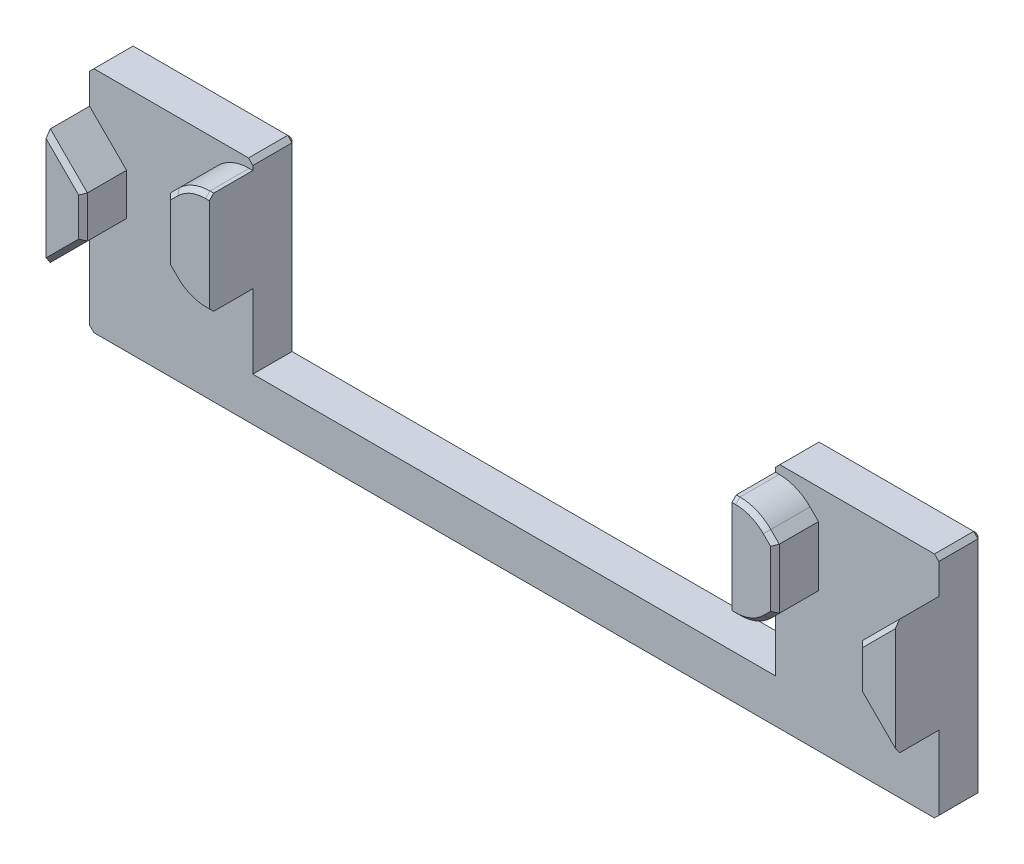
from build123d import *

# Parameters (mm, degrees)
BOSS_EXTRUDE1_DEPTH = 2
SLOT_ALIGNER_DEPTH  = 2
ALIGNER_DEPTH       = 2
DEBURS_SIZE         = 0.2


with BuildPart() as part:
    # Sketch1 → Boss-Extrude1 (new body)
    with BuildSketch(Plane.XY):
        Polygon((-19.3, -5.25), (19.3, -5.25), (19.5, -5.05), (19.5, 5.05), (19.3, 5.25), (12.2, 5.25), (12, 5.05), (12, -3.25), (-12, -3.25), (-12, 5.05), (-12.2, 5.25), (-19.3, 5.25), (-19.5, 5.05), (-19.5, -5.05), align=None)
    extrude(amount=-BOSS_EXTRUDE1_DEPTH)

    # Sketch3 → Slot Aligner (add)
    with BuildSketch(Plane.XY):
        with BuildLine():
            Line((12.171572875, 4.85), (12, 4.85))
            Line((12, 4.85), (12, 0.15))
            Line((12, 0.15), (12.171572875, 0.15))
            ThreePointArc((12.171572875, 0.15), (12.93693974, 0.302240935), (13.585786438, 0.735786438))
            Line((13.585786438, 0.735786438), (13.975, 1.125))
            Line((13.975, 1.125), (13.975, 3.875))
            Line((13.975, 3.875), (13.585786438, 4.264213562))
            ThreePointArc((13.585786438, 4.264213562), (12.93693974, 4.697759065), (12.171572875, 4.85))
        make_face()
    slot_aligner = extrude(amount=SLOT_ALIGNER_DEPTH)

    # Mirror3: Slot Aligner across plane
    add(slot_aligner.mirror(Plane(origin=(0, 0, 0), x_dir=(0, 0, 1), z_dir=(1, 0, 0))))

    # Sketch4 → Aligner (add)
    with BuildSketch(Plane.XY):
        Polygon((19.4, 3.558578644), (19.5, 3.658578644), (19.5, -1.658578644), (19.4, -1.558578644), (17.8, 0.041421356), (17.8, 1.958578644), align=None)
    aligner = extrude(amount=ALIGNER_DEPTH)

    # Aligners: Aligner across plane
    add(aligner.mirror(Plane(origin=(0, 0, 0), x_dir=(0, 0, 1), z_dir=(1, 0, 0))))

    # Deburs
    deburs_edges = [part.edges().sort_by_distance(p)[0] for p in [
        (12, 0.9, -2),
        (12.1, 5.15, -2),
        (15.75, 5.25, -2),
        (19.4, 5.15, -2),
        (19.5, 0, -2),
        (19.4, -5.15, -2),
        (0, -5.25, -2),
        (-19.4, -5.15, -2),
        (-19.5, 0, -2),
        (-19.4, 5.15, -2),
        (-15.75, 5.25, -2),
        (-12.1, 5.15, -2),
        (-12, 0.9, -2),
        (0, -3.25, -2),
        (-18.65, 2.808578644, 2),
        (-18.65, -0.808578644, 2),
        (-17.8, 1, 2),
        (18.65, -0.808578644, 2),
        (17.8, 1, 2),
        (18.65, 2.808578644, 2),
        (-12.085786438, 4.85, 2),
        (-12.085786438, 0.15, 2),
        (-12.93693974, 4.697759065, 2),
        (-12.93693974, 0.302240935, 2),
        (-13.780393219, 4.069606781, 2),
        (-13.780393219, 0.930393219, 2),
        (-13.975, 2.5, 2),
        (12.085786438, 4.85, 2),
        (12.085786438, 0.15, 2),
        (12.93693974, 4.697759065, 2),
        (12.93693974, 0.302240935, 2),
        (13.780393219, 4.069606781, 2),
        (13.975, 2.5, 2),
        (13.780393219, 0.930393219, 2),
    ]]
    chamfer(deburs_edges, length=DEBURS_SIZE)


solid = part.part
